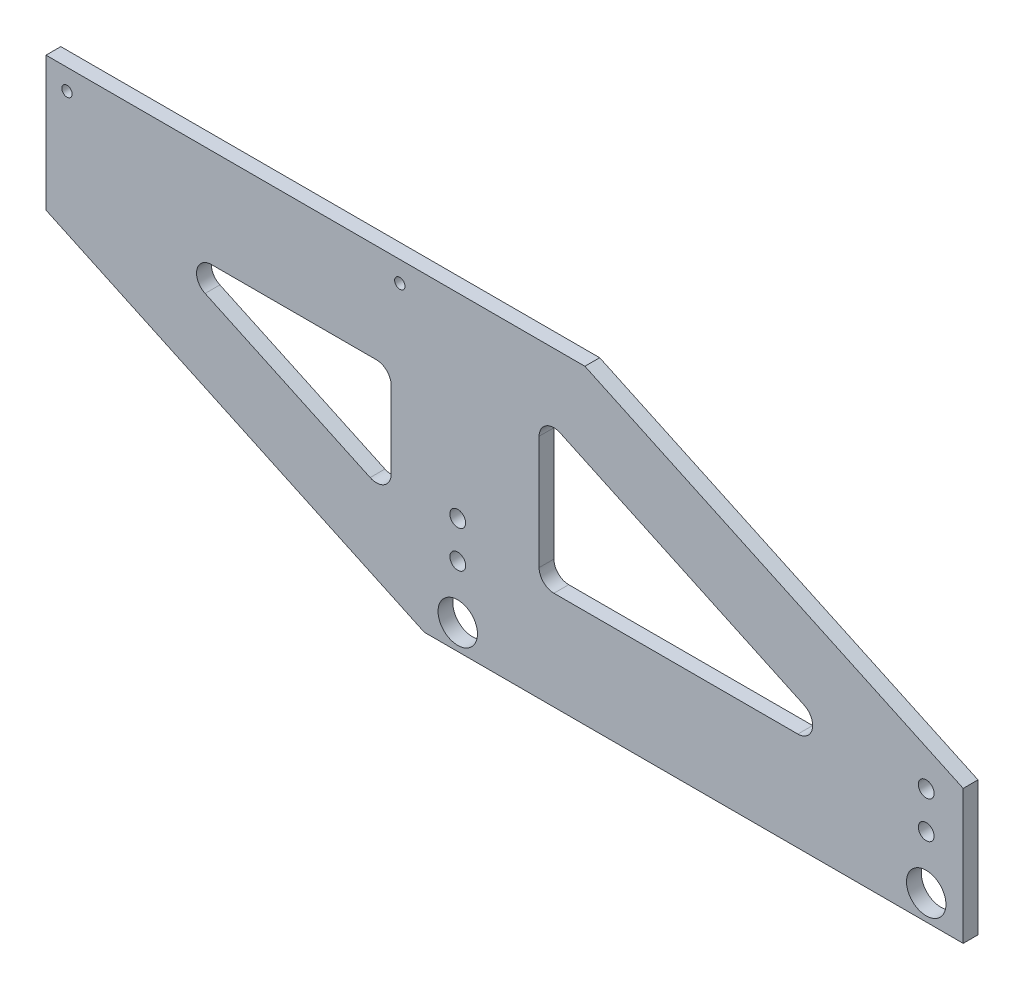
from build123d import *

# Parameters (mm, degrees)
SKETCH1_R      = 1.05
SKETCH1_R_2    = 4
SKETCH1_R_3    = 1.6
EXTRUDE1_DEPTH = 3
FILLET1_R      = 3


with BuildPart() as part:
    # Sketch1 → Extrude1 (new body)
    with BuildSketch(Plane.XY):
        Polygon((-83.5, 74.115427319), (25.779226165, 74.115427319), (102.5, 38.33994294), (102.5, 11.115427319), (-6.779226165, 11.115427319), (-83.5, 46.890911697), align=None)
        with Locations((-79.25, 69.915427319)):
            Circle(SKETCH1_R, mode=Mode.SUBTRACT)
        with Locations((-11.75, 69.915427319)):
            Circle(SKETCH1_R, mode=Mode.SUBTRACT)
        with Locations((0, 16.201854058)):
            Circle(SKETCH1_R_2, mode=Mode.SUBTRACT)
        with Locations((95, 16.201854058)):
            Circle(SKETCH1_R_2, mode=Mode.SUBTRACT)
        with Locations((95, 27)):
            Circle(SKETCH1_R_3, mode=Mode.SUBTRACT)
        with Locations((95, 34.5)):
            Circle(SKETCH1_R_3, mode=Mode.SUBTRACT)
        with Locations((0, 34.5)):
            Circle(SKETCH1_R_3, mode=Mode.SUBTRACT)
        with Locations((0, 27)):
            Circle(SKETCH1_R_3, mode=Mode.SUBTRACT)
        Polygon((-63.5, 54.115427319), (-13.5, 54.115427319), (-13.5, 30.800044411), align=None, mode=Mode.SUBTRACT)
        Polygon((16.5, 61.891732757), (16.5, 31.115427319), (82.5, 31.115427319), align=None, mode=Mode.SUBTRACT)
    extrude(amount=EXTRUDE1_DEPTH)

    # Fillet1
    fillet1_edges = [part.edges().sort_by_distance(p)[0] for p in [
        (82.5, 31.115427319, 1.5),
        (16.5, 31.115427319, 1.5),
        (16.5, 61.891732757, 1.5),
        (-13.5, 30.800044411, 1.5),
        (-63.5, 54.115427319, 1.5),
        (-13.5, 54.115427319, 1.5),
    ]]
    fillet(fillet1_edges, radius=FILLET1_R)


solid = part.part
